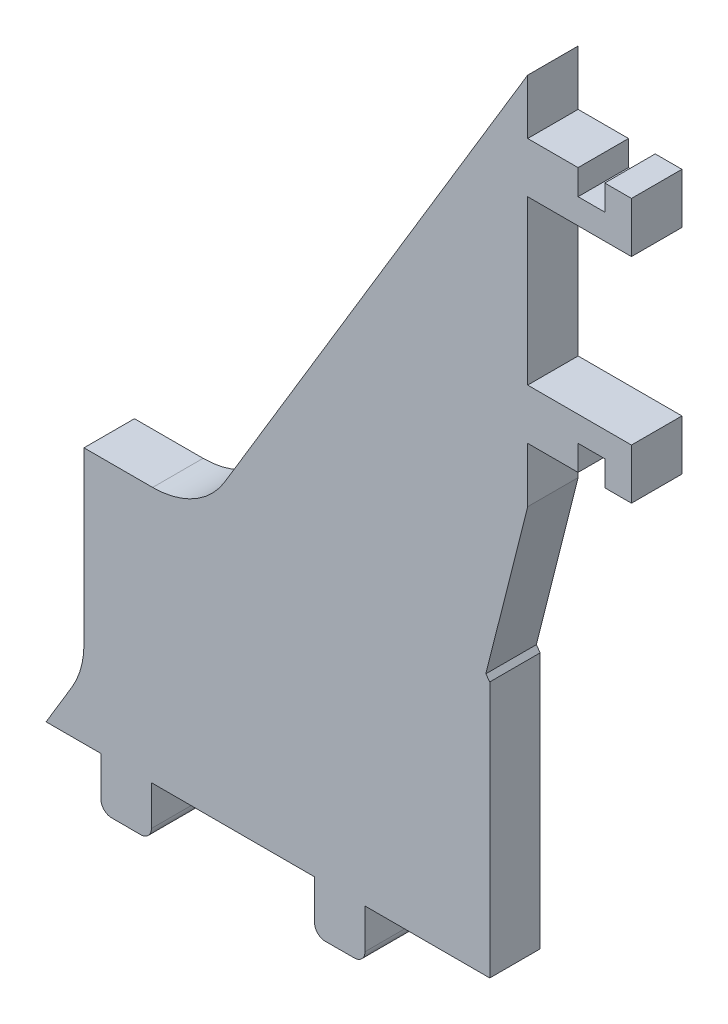
from build123d import *

# Parameters (mm, degrees)
BOSS_EXTRUDE1_DEPTH = 6
SKETCH3_W           = 48.26
SKETCH3_H           = 30.48
BOSS_EXTRUDE2_DEPTH = 6
CHAMFER1_SIZE       = 0.635
FILLET1_R           = 10
SKETCH4_W           = 31.3944
SKETCH4_H           = 6.3444
CUT_EXTRUDE1_DEPTH  = 73.882968029
FILLET2_R           = 1.27


with BuildPart() as part:
    # Sketch1 → Boss-Extrude1 (new body)
    with BuildSketch(Plane.XY):
        Polygon((28.6385, 47.625), (28.6385, 41.0972), (34.6329, 41.0972), (34.6329, 38.1), (37.8079, 38.1), (37.8079, 41.0972), (40.9829, 41.0972), (40.9829, 35.1028), (28.6385, 35.1028), (28.6385, 15.6972), (40.9829, 15.6972), (40.9829, 9.7028), (37.8079, 9.7028), (37.8079, 12.7), (34.6329, 12.7), (34.6329, 9.7028), (28.6385, 9.7028), (28.6385, 3.175), (15.8115, -47.625), (9.2837, -47.625), (9.2837, -53.6194), (6.2865, -53.6194), (6.2865, -56.7944), (9.2837, -56.7944), (9.2837, -59.9694), (3.2893, -59.9694), (3.2893, -47.625), (-16.1163, -47.625), (-16.1163, -59.9694), (-22.1107, -59.9694), (-22.1107, -56.7944), (-19.1135, -56.7944), (-19.1135, -53.6194), (-22.1107, -53.6194), (-22.1107, -47.625), (-28.6385, -47.625), align=None)
    extrude(amount=BOSS_EXTRUDE1_DEPTH)

    # Sketch3 → Boss-Extrude2 (add)
    with BuildSketch(Plane.XY.offset(6)):
        with Locations((0, -32.385)):
            Rectangle(SKETCH3_W, SKETCH3_H)
    extrude(amount=-BOSS_EXTRUDE2_DEPTH)

    # Chamfer1
    # the kernel refuses this chamfer: 0.635 mm, written as the material it adds along each edge
    with BuildSketch(Plane(origin=(23.5077, -17.145, 6), x_dir=(0.9995260143911436, -0.0307854926118649, 0), z_dir=(0, 0, -1))) as chamfer1_piece_1_section:
        Polygon((CHAMFER1_SIZE * 0.999526014391, -CHAMFER1_SIZE * 0.0307854926119), (CHAMFER1_SIZE * 0.214851580859, -CHAMFER1_SIZE * 0.976646711049), (0, 0), align=None)
    chamfer1_piece_1 = extrude(amount=6, mode=Mode.PRIVATE)
    chamfer1_piece_1 = split(chamfer1_piece_1, bisect_by=Plane(origin=(24.13, -16.940914613, 3), z_dir=(-1, 0, 0)), keep=Keep.TOP, mode=Mode.PRIVATE)
    add(chamfer1_piece_1)

    # Fillet1
    fillet1_edges = [part.edges().sort_by_distance(p)[0] for p in [
        (-10.30986, -17.145, 3),
        (-24.13, -40.127494457, 3),
    ]]
    fillet(fillet1_edges, radius=FILLET1_R)

    # Sketch4 → Cut-Extrude1 (cut, through all)
    with BuildSketch(Plane.XY.offset(6)):
        with Locations((-6.4135, -56.7972)):
            Rectangle(SKETCH4_W, SKETCH4_H)
    extrude(amount=-CUT_EXTRUDE1_DEPTH, mode=Mode.SUBTRACT)

    # Fillet2
    fillet2_edges = [part.edges().sort_by_distance(p)[0] for p in [
        (-16.1163, -53.625, 3),
        (3.2893, -53.625, 3),
        (9.2837, -53.6194, 3),
        (-22.1107, -53.6194, 3),
    ]]
    fillet(fillet2_edges, radius=FILLET2_R)


solid = part.part
